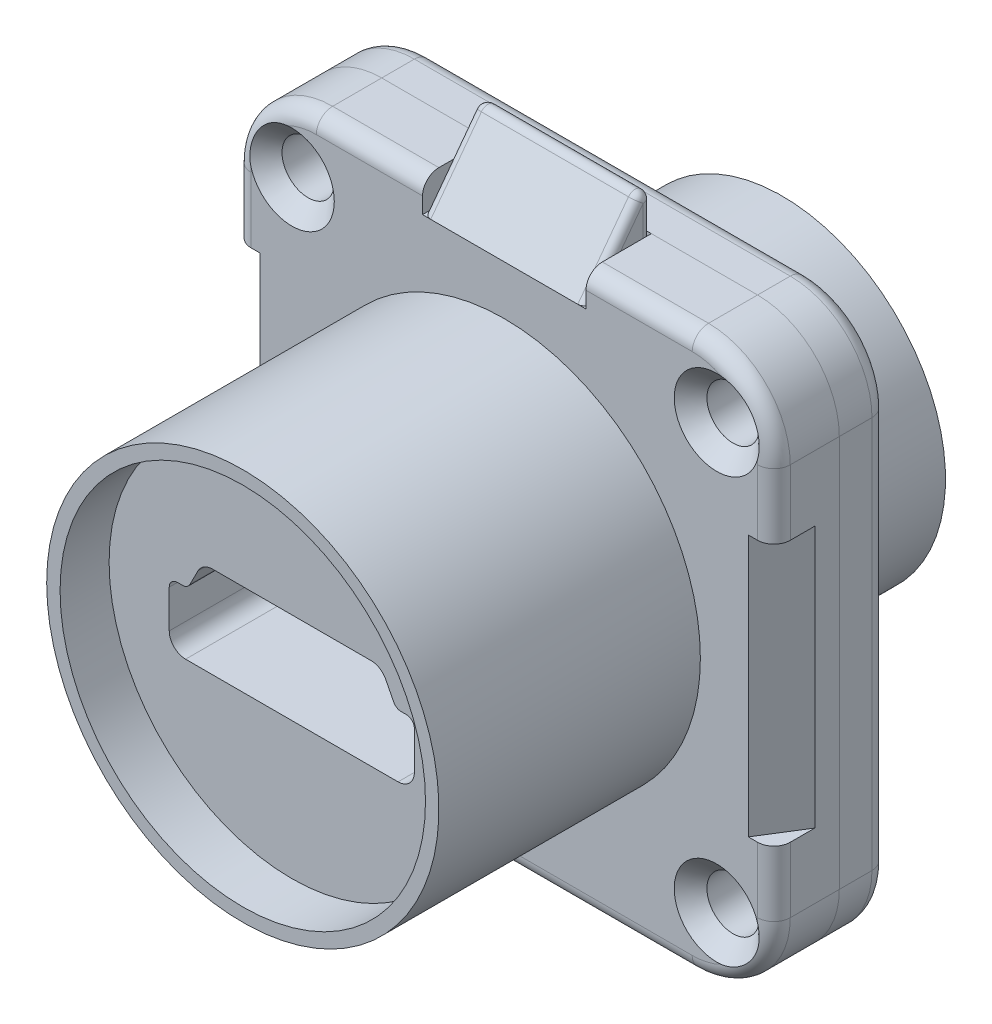
from build123d import *
from OCP.BRepFilletAPI import BRepFilletAPI_MakeFillet

# Parameters (mm, degrees)
SKETCH1_W           = 33
SKETCH1_H           = 34
SKETCH1_R           = 12
SKETCH1_R_2         = 1.6
BOSS_EXTRUDE1_DEPTH = 4
SKETCH2_R           = 12
BOSS_EXTRUDE2_DEPTH = 20
FILLET1_R           = 5
CHAMFER1_SIZE       = 1
SKETCH3_R           = 1.6
BOSS_EXTRUDE3_DEPTH = 3
SKETCH5_R           = 10
BOSS_EXTRUDE4_DEPTH = 10
CUT_EXTRUDE1_DEPTH  = 12
SKETCH9_R           = 9.391280131
SKETCH9_R_2         = 8.682947415
CUT_EXTRUDE2_DEPTH  = 10
SKETCH10_R          = 11.180433554
CUT_EXTRUDE3_DEPTH  = 3
CUT_EXTRUDE4_DEPTH  = 12
FILLET3_R1          = 0.5
FILLET3_R2          = 1
FILLET4_R1          = 0.5
FILLET4_R2          = 1
FILLET5_R           = 1
FILLET6_R           = 1
CUT_EXTRUDE5_DEPTH  = 8
CUT_EXTRUDE6_DEPTH  = 5
BOSS_EXTRUDE5_DEPTH = 5
FILLET7_R           = 0.5


with BuildPart() as part:
    # Sketch1 → Boss-Extrude1 (new body)
    with BuildSketch(Plane.XY):
        Rectangle(SKETCH1_W, SKETCH1_H)
        Circle(SKETCH1_R, mode=Mode.SUBTRACT)
        with Locations((-13, 13)):
            Circle(SKETCH1_R_2, mode=Mode.SUBTRACT)
        with Locations((13, -13)):
            Circle(SKETCH1_R_2, mode=Mode.SUBTRACT)
        with Locations(Location((-13, -13, 0), (0, 0, 180))):
            Circle(SKETCH1_R_2, mode=Mode.SUBTRACT)
        with Locations(Location((13, 13, 0), (0, 0, 180))):
            Circle(SKETCH1_R_2, mode=Mode.SUBTRACT)
    extrude(amount=BOSS_EXTRUDE1_DEPTH)

    # Sketch2 → Boss-Extrude2 (add)
    with BuildSketch(Plane(origin=(0, 0, 0), x_dir=(-1, 0, 0), z_dir=(0, 0, -1))):
        Circle(SKETCH2_R)
    extrude(amount=-BOSS_EXTRUDE2_DEPTH)

    # Fillet1
    fillet1_edges = [part.edges().sort_by_distance(p)[0] for p in [
        (16.5, -17, 2),
        (-16.5, -17, 2),
        (-16.5, 17, 2),
        (16.5, 17, 2),
    ]]
    fillet(fillet1_edges, radius=FILLET1_R)

    # Chamfer1
    chamfer1_edges = [part.edges().sort_by_distance(p)[0] for p in [
        (-14.6, 13, 4),
        (11.4, -13, 4),
        (-11.4, -13, 4),
        (14.6, 13, 4),
    ]]
    chamfer(chamfer1_edges, length=CHAMFER1_SIZE)

    # Sketch10 → Cut-Extrude3 (cut)
    with BuildSketch(Plane.XY.offset(20)):
        Circle(SKETCH10_R)
    extrude(amount=-CUT_EXTRUDE3_DEPTH, mode=Mode.SUBTRACT)

    # Sketch11 → Cut-Extrude4 (cut)
    with BuildSketch(Plane.XY.offset(17)):
        Polygon((7.5, 1.02), (7.5, -2.8), (-7.5, -2.8), (-7.5, 1.02), (-6.376921049, 1.02), (-5.465, 2.8), (5.465, 2.8), (6.376921049, 1.02), align=None)
    extrude(amount=-CUT_EXTRUDE4_DEPTH, mode=Mode.SUBTRACT)

    # Fillet3: one fillet with a radius per group of edges: ONE call of the kernel's fillet builder (fillet() takes one radius for all edges)
    fillet3_edges_1 = [part.edges().sort_by_distance(p)[0] for p in [
        (-6.376921049, 1.02, 11),
        (-7.5, 1.02, 11),
        (6.376921049, 1.02, 11),
        (7.5, 1.02, 11),
    ]]
    fillet3_edges_2 = [part.edges().sort_by_distance(p)[0] for p in [
        (-5.465, 2.8, 11),
        (-7.5, -2.8, 11),
        (7.5, -2.8, 11),
        (5.465, 2.8, 11),
    ]]
    fillet3 = BRepFilletAPI_MakeFillet(part.part.solid().wrapped)
    for e in fillet3_edges_1:
        fillet3.Add(FILLET3_R1, e.wrapped)
    for e in fillet3_edges_2:
        fillet3.Add(FILLET3_R2, e.wrapped)
    add(Compound.cast(fillet3.Shape()), mode=Mode.REPLACE)

    # Fillet5
    # the kernel refuses this fillet: 1 mm, written as the material it takes off along each edge
    with BuildSketch(Plane(origin=(-11.5, 17, 4), x_dir=(0, -1, 0), z_dir=(1, 0, 0)), Plane(origin=(11.5, -17, 4), x_dir=(0, 1, 0), z_dir=(-1, 0, 0))) as fillet5_piece_1:
        with BuildLine():
            CenterArc((FILLET5_R, FILLET5_R), FILLET5_R, 180, 90)
            Line((0, FILLET5_R), (0, 0))
            Line((0, 0), (FILLET5_R, 0))
        make_face()
    extrude(amount=23, mode=Mode.SUBTRACT)
    with BuildSketch(Plane(origin=(16.5, 12, 4), x_dir=(-1, 0, 0), z_dir=(0, -1, 0)), Plane(origin=(-16.5, -12, 4), x_dir=(1, 0, 0), z_dir=(0, 1, 0))) as fillet5_piece_2:
        with BuildLine():
            CenterArc((FILLET5_R, FILLET5_R), FILLET5_R, 180, 90)
            Line((0, FILLET5_R), (0, 0))
            Line((0, 0), (FILLET5_R, 0))
        make_face()
    extrude(amount=24, mode=Mode.SUBTRACT)
    with BuildSketch(Plane(origin=(-11.5, 12, 4), x_dir=(0, 1, 0), z_dir=(1, 0, 0))) as fillet5_piece_3:
        with BuildLine():
            CenterArc((5 - FILLET5_R, -FILLET5_R), FILLET5_R, 0, 90)
            Line((5, -FILLET5_R), (5, 0))
            Line((5, 0), (5 - FILLET5_R, 0))
        make_face()
    revolve(axis=Axis((-11.5, 12, 4), (0, 0, 1)), revolution_arc=90, mode=Mode.SUBTRACT)
    with BuildSketch(Plane(origin=(-11.5, -12, 4), x_dir=(0, -1, 0), z_dir=(1, 0, 0))) as fillet5_piece_4:
        with BuildLine():
            CenterArc((5 - FILLET5_R, FILLET5_R), FILLET5_R, 270, 90)
            Line((5, FILLET5_R), (5, 0))
            Line((5, 0), (5 - FILLET5_R, 0))
        make_face()
    revolve(axis=Axis((-11.5, -12, 4), (0, 0, -1)), revolution_arc=90, mode=Mode.SUBTRACT)
    with BuildSketch(Plane(origin=(11.5, -12, 4), x_dir=(0, -1, 0), z_dir=(-1, 0, 0))) as fillet5_piece_5:
        with BuildLine():
            CenterArc((5 - FILLET5_R, -FILLET5_R), FILLET5_R, 0, 90)
            Line((5, -FILLET5_R), (5, 0))
            Line((5, 0), (5 - FILLET5_R, 0))
        make_face()
    revolve(axis=Axis((11.5, -12, 4), (0, 0, 1)), revolution_arc=90, mode=Mode.SUBTRACT)
    with BuildSketch(Plane(origin=(11.5, 12, 4), x_dir=(0, 1, 0), z_dir=(-1, 0, 0))) as fillet5_piece_6:
        with BuildLine():
            CenterArc((5 - FILLET5_R, FILLET5_R), FILLET5_R, 270, 90)
            Line((5, FILLET5_R), (5, 0))
            Line((5, 0), (5 - FILLET5_R, 0))
        make_face()
    revolve(axis=Axis((11.5, 12, 4), (0, 0, -1)), revolution_arc=90, mode=Mode.SUBTRACT)

    # Sketch12 → Cut-Extrude5 (cut, symmetric)
    with BuildSketch(Plane(origin=(0, 0, 0), x_dir=(-1, 0, 0), z_dir=(0, -1, 0))):
        Polygon((14.333633482, -4.962146393), (16.5, -1.5), (16.5, -3), (16.5, -4.962146393), align=None)
        Polygon((-16.5, -4.962146393), (-14.333633482, -4.962146393), (-16.5, -1.5), (-16.5, -3), align=None)
    extrude(amount=CUT_EXTRUDE5_DEPTH, both=True, mode=Mode.SUBTRACT)

    # Sketch13 → Cut-Extrude6 (cut, symmetric)
    with BuildSketch(Plane(origin=(0, 0, 0), x_dir=(0, 0, -1), z_dir=(1, 0, 0))):
        Polygon((-3, 17), (0, 17), (0, 15.007428725), (-3, 15.007428725), (-4.179389898, 15.007428725), (-4.179389898, 17), align=None)
    extrude(amount=CUT_EXTRUDE6_DEPTH, both=True, mode=Mode.SUBTRACT)


with BuildPart() as body_2:
    # Sketch3 → Boss-Extrude3 (new body)
    with BuildSketch(Plane(origin=(0, 0, 0), x_dir=(-1, 0, 0), z_dir=(0, 0, -1))):
        with BuildLine():
            Line((11.5, 17), (-11.5, 17))
            ThreePointArc((-11.5, 17), (-15.035533906, 15.535533906), (-16.5, 12))
            Line((-16.5, 12), (-16.5, -12))
            ThreePointArc((-16.5, -12), (-15.035533906, -15.535533906), (-11.5, -17))
            Line((-11.5, -17), (11.5, -17))
            ThreePointArc((11.5, -17), (15.035533906, -15.535533906), (16.5, -12))
            Line((16.5, -12), (16.5, 12))
            ThreePointArc((16.5, 12), (15.035533906, 15.535533906), (11.5, 17))
        make_face()
        with Locations((13, 13)):
            Circle(SKETCH3_R, mode=Mode.SUBTRACT)
        with Locations((-13, -13)):
            Circle(SKETCH3_R, mode=Mode.SUBTRACT)
        with Locations((-13, 13)):
            Circle(SKETCH3_R, mode=Mode.SUBTRACT)
        with Locations((13, -13)):
            Circle(SKETCH3_R, mode=Mode.SUBTRACT)
    extrude(amount=BOSS_EXTRUDE3_DEPTH)

    # Sketch5 → Boss-Extrude4 (add)
    with BuildSketch(Plane(origin=(0, 0, -3), x_dir=(-1, 0, 0), z_dir=(0, 0, -1))):
        Circle(SKETCH5_R)
    extrude(amount=BOSS_EXTRUDE4_DEPTH)

    # Sketch6 → Cut-Extrude1 (cut)
    with BuildSketch(Plane(origin=(0, 0, -13), x_dir=(-1, 0, 0), z_dir=(0, 0, -1))):
        Polygon((-7.5, -2.8), (7.5, -2.8), (7.5, 1.02), (6.376921049, 1.02), (5.465, 2.8), (-5.465, 2.8), (-6.376921049, 1.02), (-7.5, 1.02), align=None)
    extrude(amount=-CUT_EXTRUDE1_DEPTH, mode=Mode.SUBTRACT)

    # Sketch9 → Cut-Extrude2 (cut)
    with BuildSketch(Plane(origin=(0, 0, -13), x_dir=(-1, 0, 0), z_dir=(0, 0, -1))):
        Circle(SKETCH9_R)
        Circle(SKETCH9_R_2, mode=Mode.SUBTRACT)
    extrude(amount=-CUT_EXTRUDE2_DEPTH, mode=Mode.SUBTRACT)

    # Fillet4: one fillet with a radius per group of edges: ONE call of the kernel's fillet builder (fillet() takes one radius for all edges)
    fillet4_edges_1 = [body_2.edges().sort_by_distance(p)[0] for p in [
        (6.376921049, 1.02, -7),
        (7.5, 1.02, -7),
        (-6.376921049, 1.02, -7),
        (-7.5, 1.02, -7),
    ]]
    fillet4_edges_2 = [body_2.edges().sort_by_distance(p)[0] for p in [
        (5.465, 2.8, -7),
        (-5.465, 2.8, -7),
        (7.5, -2.8, -7),
        (-7.5, -2.8, -7),
    ]]
    fillet4 = BRepFilletAPI_MakeFillet(body_2.part.solid().wrapped)
    for e in fillet4_edges_1:
        fillet4.Add(FILLET4_R1, e.wrapped)
    for e in fillet4_edges_2:
        fillet4.Add(FILLET4_R2, e.wrapped)
    add(Compound.cast(fillet4.Shape()), mode=Mode.REPLACE)

    # Fillet6
    fillet6_edges = [body_2.edges().sort_by_distance(p)[0] for p in [
        (15.035533906, 15.535533906, -3),
        (16.5, 0, -3),
        (15.035533906, -15.535533906, -3),
        (0, -17, -3),
        (-15.035533906, -15.535533906, -3),
        (-16.5, 0, -3),
        (-15.035533906, 15.535533906, -3),
        (0, 17, -3),
    ]]
    fillet(fillet6_edges, radius=FILLET6_R)


with BuildPart() as body_3:
    # Sketch14 → Boss-Extrude5 (new, symmetric)
    with BuildSketch(Plane(origin=(0, 0, 0), x_dir=(0, 0, -1), z_dir=(1, 0, 0))):
        Polygon((-4, 15.007428725), (0, 15.007428725), (0, 20.357898526), align=None)
    extrude(amount=BOSS_EXTRUDE5_DEPTH, both=True)

    # Fillet7
    fillet7_edges = [body_3.edges().sort_by_distance(p)[0] for p in [
        (5, 17.682663626, 0),
        (-5, 17.682663626, 0),
        (5, 17.682663626, 2),
        (-5, 17.682663626, 2),
        (0, 20.357898526, 0),
    ]]
    fillet(fillet7_edges, radius=FILLET7_R)


solid = Compound([part.part, body_2.part, body_3.part])
